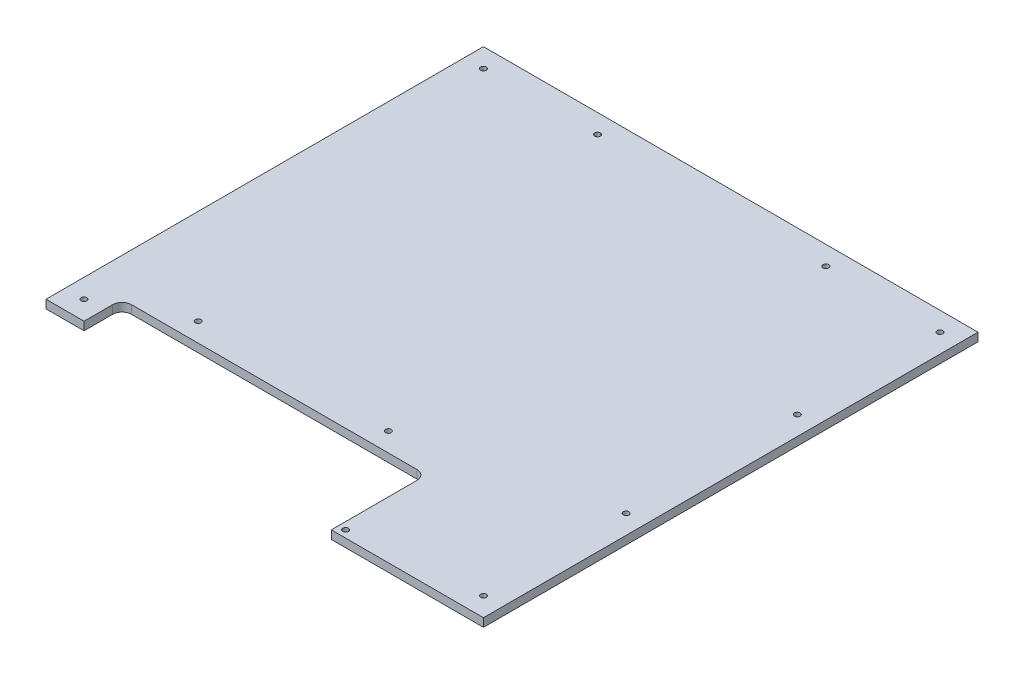
from build123d import *

# Parameters (mm, degrees)
BOSS_EXTRUDE1_DEPTH                 = 5.588
F_6_CLEARANCE_HOLE1_D               = 3.7973
F_6_CLEARANCE_HOLE3_NO_MOUNT_SIDE_D = 3.7973
FILLET1_R                           = 6.35


with BuildPart() as part:
    # Sketch1 → Boss-Extrude1 (new body)
    with BuildSketch(Plane(origin=(0, 0, 0), x_dir=(1, 0, 0), z_dir=(0, 1, 0))):
        Polygon((-165.1, -127), (-165.1, 165.1), (165.1, 165.1), (165.1, -165.1), (63.5, -165.1), (63.5, -101.6), (-139.7, -101.6), (-139.7, -127), align=None)
    extrude(amount=BOSS_EXTRUDE1_DEPTH)

    # #6 Clearance Hole1 (through all)
    with Locations(Plane(origin=(-76.2, 5.588, -152.4), x_dir=(0, 0, 1), z_dir=(0, 1, 0))):
        with Locations((0, 0), (0, 152.4), (0, -76.2), (0, 228.6), (304.8, 228.6), (312.7375, 144.4625), (266.7, -76.2), (241.3, -25.4), (241.3, 101.6)):
            Hole(F_6_CLEARANCE_HOLE1_D / 2)

    # #6 Clearance Hole3 - No Mount Side (through all)
    with Locations(Plane(origin=(152.4, 5.588, -57.15), x_dir=(0, 0, 1), z_dir=(0, 1, 0))):
        with Locations((0, 0), (114.3, 0)):
            Hole(F_6_CLEARANCE_HOLE3_NO_MOUNT_SIDE_D / 2)

    # Fillet1
    fillet1_edges = [part.edges().sort_by_distance(p)[0] for p in [
        (-139.7, 2.794, 101.6),
        (63.5, 2.794, 101.6),
    ]]
    fillet(fillet1_edges, radius=FILLET1_R)


solid = part.part
